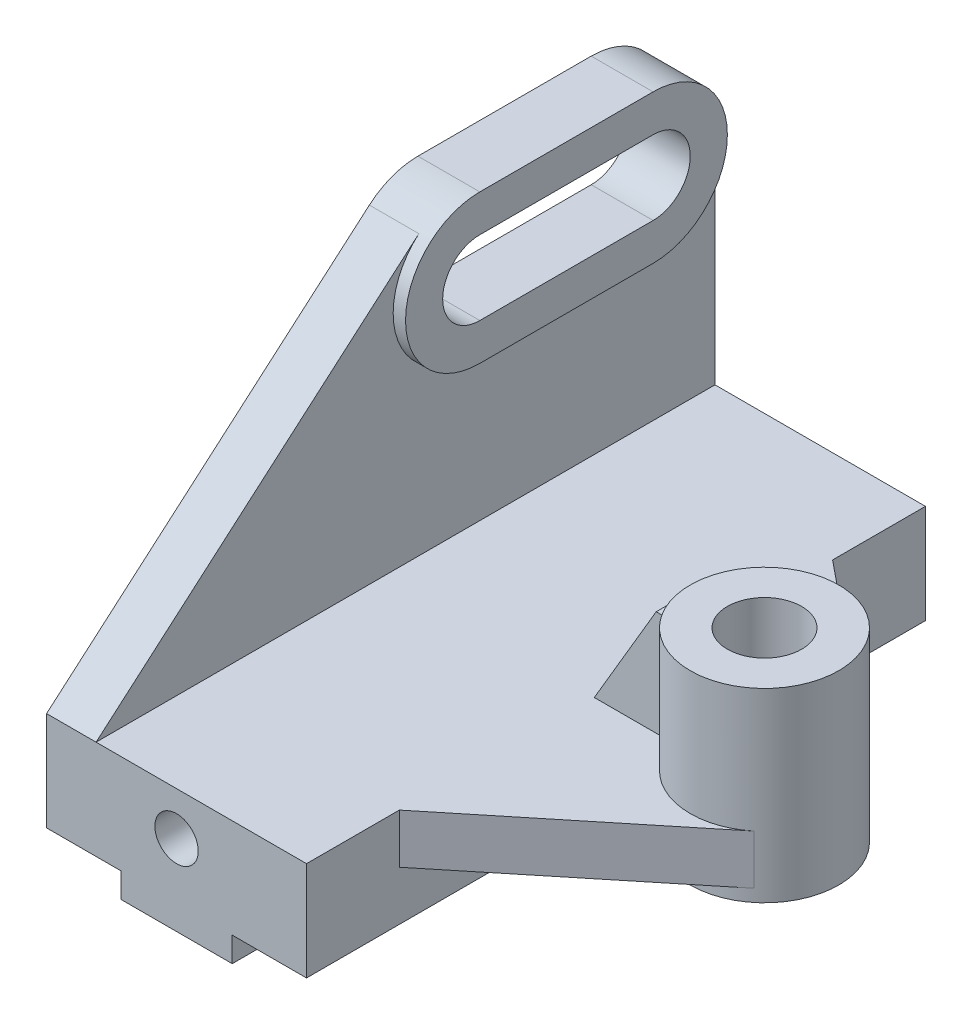
from build123d import *

# Parameters (mm, degrees)
EXTRUDE_1_DEPTH      = 8
EXTRUDE_2_DEPTH      = 10
SKETCH_1_5_W         = 100
SKETCH_1_5_H         = 16
EXTRUDE_3_DEPTH      = 42
EXTRUDE_START        = 12
SKETCH_1_6_W         = 100
SKETCH_1_6_H         = 4
EXTRUDE_4_DEPTH      = 18
SKETCH_2_R           = 3.5
CUT_EXTRUDE_4_DEPTH  = 123.995934892
EXTRUDE_7_DEPTH      = 8
EXTRUDE_8_DEPTH      = 20
EXTRUDE_8_DEPTH_BACK = 10
RIB_START            = -3.5
RIB_2_DEPTH          = 7


# Read off the part's stored shape, not the designer's step: 筋2
with BuildPart() as part:
    # 草图1 → 凸台-拉伸1 (new body)
    with BuildSketch(Plane(origin=(0, 0, 0), x_dir=(0, 0, -1), z_dir=(1, 0, 0))):
        with BuildLine():
            Line((2.152816021, 55.078639964), (-50, 10))
            Line((-50, 10), (50, 10))
            Line((50, 10), (50, 46))
            ThreePointArc((50, 46), (46.485281374, 37.514718626), (38, 34))
            Line((38, 34), (10, 34))
            ThreePointArc((10, 34), (-1.245969935, 41.813335431), (2.152816021, 55.078639964))
        make_face()
    extrude(amount=EXTRUDE_1_DEPTH)

    # 草图1<3> → 凸台-拉伸2 (add)
    with BuildSketch(Plane(origin=(0, 0, 0), x_dir=(0, 0, -1), z_dir=(1, 0, 0))):
        with BuildLine():
            ThreePointArc((38, 34), (50, 46), (38, 58))
            Line((38, 58), (10, 58))
            ThreePointArc((10, 58), (-2, 46), (10, 34))
            Line((10, 34), (38, 34))
        make_face()
        with BuildLine():
            ThreePointArc((38, 40), (44, 46), (38, 52))
            Line((38, 52), (10, 52))
            ThreePointArc((10, 52), (4, 46), (10, 40))
            Line((10, 40), (38, 40))
        make_face(mode=Mode.SUBTRACT)
    extrude(amount=EXTRUDE_2_DEPTH)

    # 草图1<5> → 凸台-拉伸3 (add)
    with BuildSketch(Plane(origin=(0, 0, 0), x_dir=(0, 0, -1), z_dir=(1, 0, 0))):
        with Locations((0, 2)):
            Rectangle(SKETCH_1_5_W, SKETCH_1_5_H)
    extrude(amount=EXTRUDE_3_DEPTH)

    # 草图1<6> → 凸台-拉伸4 (add)
    with BuildSketch(Plane(origin=(0, 0, 0), x_dir=(0, 0, -1), z_dir=(1, 0, 0)).offset(EXTRUDE_START)):
        with Locations((0, -8)):
            Rectangle(SKETCH_1_6_W, SKETCH_1_6_H)
    extrude(amount=EXTRUDE_4_DEPTH)

    # 草图2 → 切除-拉伸4 (cut, through all)
    with BuildSketch(Plane.XY.offset(50)):
        with Locations((21, 3)):
            Circle(SKETCH_2_R)
    extrude(amount=-CUT_EXTRUDE_4_DEPTH, mode=Mode.SUBTRACT)

    # 草图4 → 凸台-拉伸7 (add)
    with BuildSketch(Plane(origin=(0, 10, 0), x_dir=(1, 0, 0), z_dir=(0, 1, 0))):
        with BuildLine():
            ThreePointArc((54, 0), (60.846702456, 10.837136357), (73.573920737, 9.307831362))
            Line((73.573920737, 9.307831362), (42, 35))
            Line((42, 35), (42, 0))
            Line((42, 0), (54, 0))
        make_face()
        with BuildLine():
            Line((42, -35), (73.573920737, -9.307831362))
            ThreePointArc((73.573920737, -9.307831362), (60.846702456, -10.837136357), (54, 0))
            Line((54, 0), (42, 0))
            Line((42, 0), (42, -35))
        make_face()
    extrude(amount=-EXTRUDE_7_DEPTH)

    # 草图4<3> → 凸台-拉伸8 (add, two sides: drawn at the far end of the back side and taken through both)
    with BuildSketch(Plane(origin=(0, 10, 0), x_dir=(1, 0, 0), z_dir=(0, 1, 0)).offset(-EXTRUDE_8_DEPTH_BACK)):
        with BuildLine():
            ThreePointArc((60, 0), (66, 6), (72, 0))
            Line((72, 0), (78, 0))
            ThreePointArc((78, 0), (76.837136357, 5.153297544), (73.573920737, 9.307831362))
            ThreePointArc((73.573920737, 9.307831362), (60.846702456, 10.837136357), (54, 0))
            Line((54, 0), (60, 0))
        make_face()
        with BuildLine():
            Line((78, 0), (72, 0))
            ThreePointArc((72, 0), (66, -6), (60, 0))
            Line((60, 0), (54, 0))
            ThreePointArc((54, 0), (60.846702456, -10.837136357), (73.573920737, -9.307831362))
            ThreePointArc((73.573920737, -9.307831362), (76.837136357, -5.153297544), (78, 0))
        make_face()
    extrude(amount=EXTRUDE_8_DEPTH + EXTRUDE_8_DEPTH_BACK)

    # 筋2 outline → 筋2 (add)
    with BuildSketch(Plane.XY.offset(RIB_START)):
        Polygon((56, 27), (52, 27), (42, 10), (56, 10), align=None)
    extrude(amount=RIB_2_DEPTH)


solid = part.part
